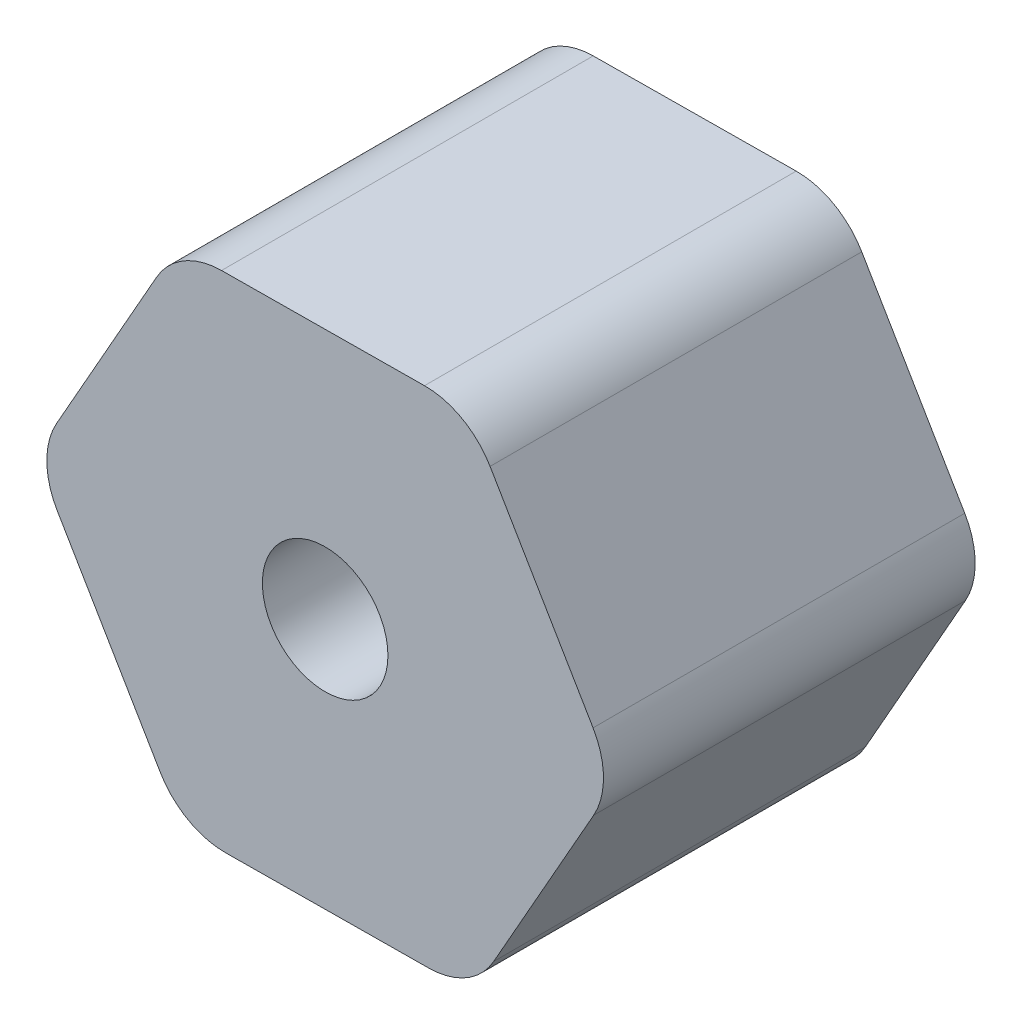
from build123d import *

# Parameters (mm, degrees)
CROQUIS1_R              = 2.5
SALIENTE_EXTRUIR1_DEPTH = 14.8


with BuildPart() as part:
    # Croquis1 → Saliente-Extruir1 (new body)
    with BuildSketch(Plane.XY):
        with BuildLine():
            Line((3.956349496, 10.033973889), (-4.126262571, 9.965304337))
            ThreePointArc((-4.126262571, 9.965304337), (-5.622793832, 9.550651573), (-6.71150154, 8.443286114))
            Line((-6.71150154, 8.443286114), (-10.693337998, 1.40920396))
            ThreePointArc((-10.693337998, 1.40920396), (-11.082503801, -0.094156513), (-10.667851037, -1.590687774))
            Line((-10.667851037, -1.590687774), (-6.567075427, -8.556100377))
            ThreePointArc((-6.567075427, -8.556100377), (-5.459709969, -9.644808085), (-3.956349496, -10.033973889))
            Line((-3.956349496, -10.033973889), (4.126262571, -9.965304337))
            ThreePointArc((4.126262571, -9.965304337), (5.622793832, -9.550651573), (6.71150154, -8.443286114))
            Line((6.71150154, -8.443286114), (10.693337998, -1.40920396))
            ThreePointArc((10.693337998, -1.40920396), (11.082503801, 0.094156513), (10.667851037, 1.590687774))
            Line((10.667851037, 1.590687774), (6.567075427, 8.556100377))
            ThreePointArc((6.567075427, 8.556100377), (5.459709969, 9.644808085), (3.956349496, 10.033973889))
        make_face()
        Circle(CROQUIS1_R, mode=Mode.SUBTRACT)
    extrude(amount=SALIENTE_EXTRUIR1_DEPTH)


solid = part.part
